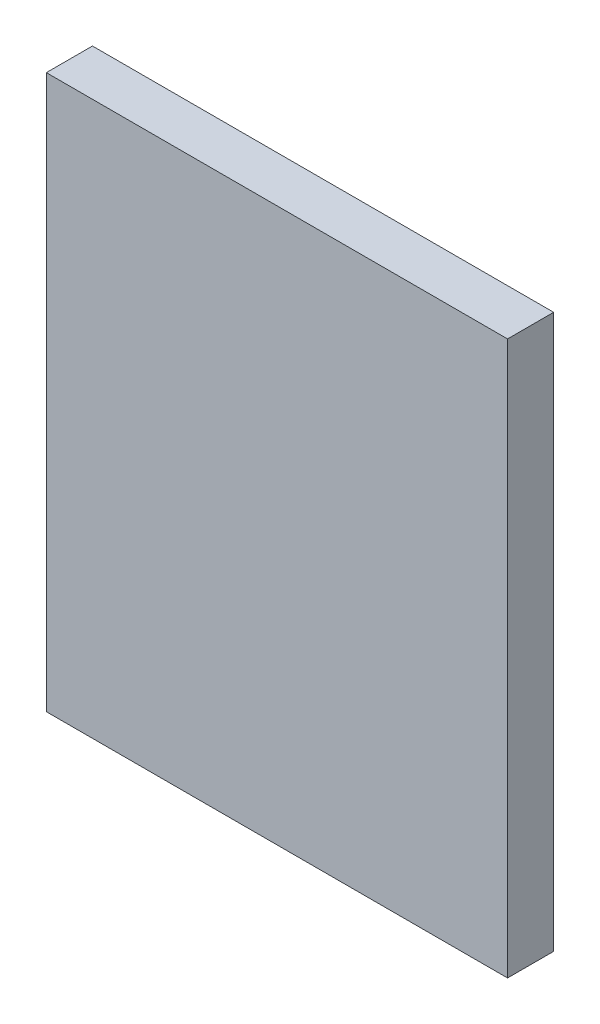
from build123d import *

# Parameters (mm, degrees)
SKETCH_1_W      = 50
SKETCH_1_H      = 60
EXTRUDE_1_DEPTH = 5


with BuildPart() as part:
    # 草图1 → 凸台-拉伸1 (new body)
    with BuildSketch(Plane.XY):
        with Locations((25, 30)):
            Rectangle(SKETCH_1_W, SKETCH_1_H)
    extrude(amount=EXTRUDE_1_DEPTH)


solid = part.part
